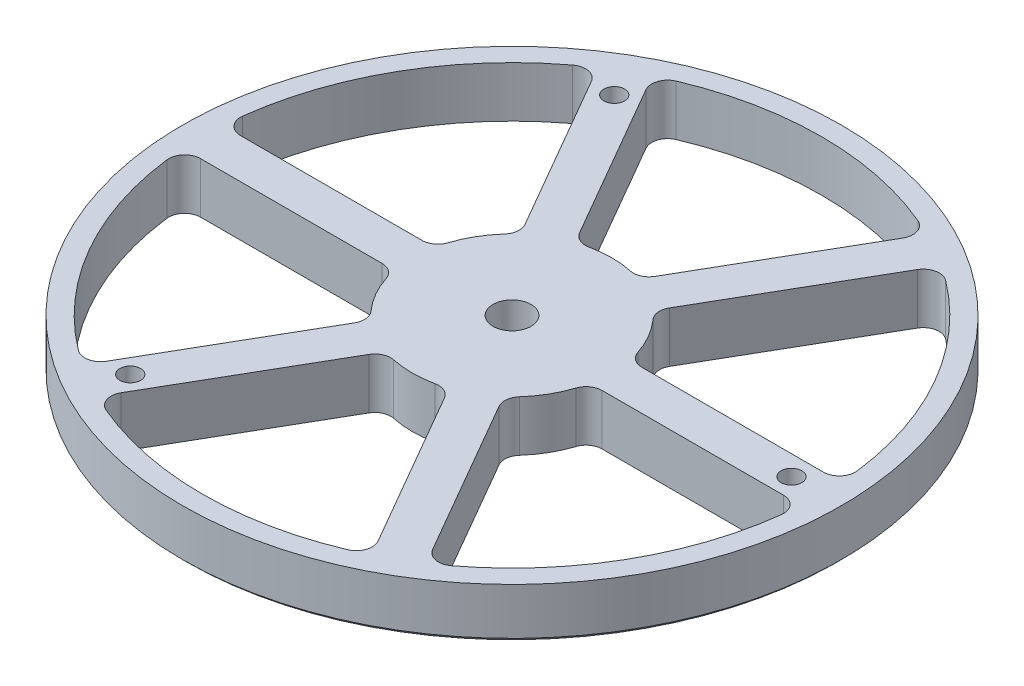
from build123d import *

# Parameters (mm, degrees)
F_6_0_204_DIAMETER_HOLE1_D   = 5.1816
CIRPATTERN3_COUNT            = 3
CUT_EXTRUDE1_DEPTH           = 118.43208675655899
FILLET1_R                    = 4
CIRPATTERN4_COUNT            = 6
FILLET1_OF_CIRPATTERN4_R     = 4
CHAMFER2_SIZE                = 1
F_3_8_0_375_DIAMETER_HOLE1_D = 9.525


with BuildPart() as part:
    # Sketch2 → Revolve1 (revolve)
    with BuildSketch(Plane(origin=(0, 0, 0), x_dir=(0, 0, -1), z_dir=(1, 0, 0))):
        Polygon((0, 0), (-82.55, -1.011e-14), (-82.55, 12.699999999999989), (0, 12.699999999999989), align=None)
    revolve(axis=Axis((0, -0.6350000000000106, 0), (0, 1, 0)))

    # #6 (0.204) Diameter Hole1 (through all)
    with Locations(Plane(origin=(0, 12.699999999999989, 0), x_dir=(1, 0, 0), z_dir=(0, 1, 0))):
        with Locations((-35, 60.621778265)):
            f_6_0_204_diameter_hole1 = Hole(F_6_0_204_DIAMETER_HOLE1_D / 2)

    # CirPattern3: #6 (0.204) Diameter Hole1 ×3 about axis
    cirpattern3_axis = Axis((0, -0.6350000000000106, 0), (0, 1, 0))
    for i in range(1, CIRPATTERN3_COUNT):
        add(f_6_0_204_diameter_hole1.rotate(cirpattern3_axis, i * 360 / CIRPATTERN3_COUNT), mode=Mode.SUBTRACT)

    # Sketch8 → Cut-Extrude1 (cut, through all)
    with BuildSketch(Plane(origin=(0, 12.699999999999989, 0), x_dir=(1, 0, 0), z_dir=(0, 1, 0))):
        with BuildLine():
            Line((-7.91732169499373, 23.713203435596423), (-34.36419588509058, 69.52053323422602))
            ThreePointArc((-34.36419588509058, 69.52053323422602), (4.75e-15, 77.55000000000001), (34.36419588509058, 69.52053323422602))
            Line((34.36419588509058, 69.52053323422602), (7.917321694993729, 23.713203435596423))
            ThreePointArc((7.917321694993729, 23.713203435596423), (1.53e-15, 25.000000000000007), (-7.91732169499373, 23.713203435596423))
        make_face()
    cut_extrude1 = extrude(amount=-CUT_EXTRUDE1_DEPTH, mode=Mode.SUBTRACT)

    # Fillet1
    fillet1_edges = [part.edges().sort_by_distance(p)[0] for p in [
        (7.9173216949937295, 6.349999999999994, -23.713203435596427),
        (34.36419588509058, 6.349999999999994, -69.52053323422604),
        (-7.9173216949937295, 6.349999999999994, -23.713203435596427),
        (-34.36419588509058, 6.349999999999994, -69.52053323422604),
    ]]
    fillet(fillet1_edges, radius=FILLET1_R)

    # CirPattern4: Cut-Extrude1 ×6 about axis
    cirpattern4_axis = Axis((0, -0.6350000000000106, 0), (0, 1, 0))
    for i in range(1, CIRPATTERN4_COUNT):
        add(cut_extrude1.rotate(cirpattern4_axis, i * 360 / CIRPATTERN4_COUNT), mode=Mode.SUBTRACT)

    # Fillet1 of CirPattern4
    fillet1_of_cirpattern4_edges = [part.edges().sort_by_distance(p)[0] for p in [
        (-16.577575732838067, 6.349999999999994, -18.713203435596455),
        (-43.02444992293479, 6.349999999999994, -64.52053323422614),
        (-24.4948974278318, 6.349999999999994, -4.999999999999974),
        (-77.38864580802537, 6.349999999999994, -4.999999999999911),
        (-24.494897427831795, 6.349999999999994, 4.999999999999966),
        (-77.38864580802539, 6.349999999999994, 4.999999999999886),
        (-16.57757573283807, 6.349999999999994, 18.713203435596448),
        (-43.024449922934814, 6.349999999999994, 64.52053323422612),
        (-7.917321694993732, 6.349999999999994, 23.713203435596427),
        (-34.36419588509059, 6.349999999999994, 69.52053323422604),
        (7.917321694993727, 6.349999999999994, 23.713203435596427),
        (34.364195885090574, 6.349999999999994, 69.52053323422604),
        (16.577575732838056, 6.349999999999994, 18.713203435596462),
        (43.024449922934764, 6.349999999999994, 64.52053323422615),
        (24.494897427831795, 6.349999999999994, 4.999999999999985),
        (77.38864580802537, 6.349999999999994, 4.99999999999994),
        (24.4948974278318, 6.349999999999994, -4.999999999999974),
        (77.38864580802537, 6.349999999999994, -4.999999999999911),
        (16.577575732838067, 6.349999999999994, -18.713203435596455),
        (43.02444992293479, 6.349999999999994, -64.52053323422614),
    ]]
    fillet(fillet1_of_cirpattern4_edges, radius=FILLET1_OF_CIRPATTERN4_R)

    # Chamfer2
    chamfer2_edges = [part.edges().sort_by_distance(p)[0] for p in [
        (4.677e-14, -1.01e-14, -82.55),
    ]]
    chamfer(chamfer2_edges, length=CHAMFER2_SIZE)

    # 3/8 (0.375) Diameter Hole1 (through all)
    with Locations(Plane(origin=(0, 0, 0), x_dir=(-1, 0, 0), z_dir=(0, -1, 0))):
        with Locations((0, 0)):
            Hole(F_3_8_0_375_DIAMETER_HOLE1_D / 2)


solid = part.part
